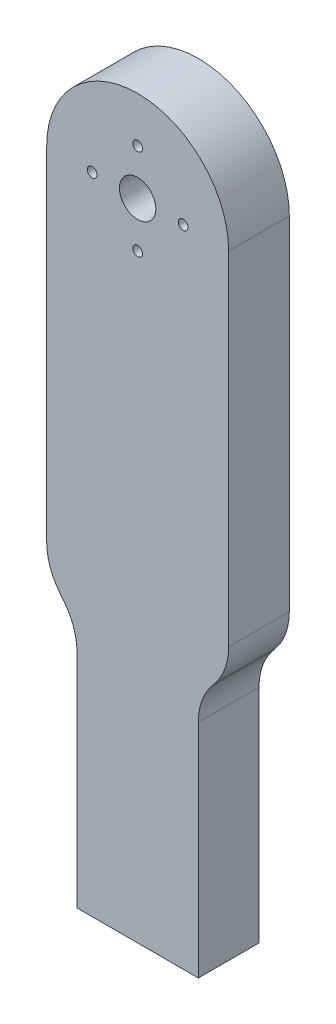
from build123d import *

# Parameters (mm, degrees)
ESQUISSE1_R        = 0.8
ESQUISSE1_R_2      = 3
BOSS_EXTRU_1_DEPTH = 5


with BuildPart() as part:
    # Esquisse1 → Boss.-Extru.1 (new, symmetric)
    with BuildSketch(Plane.XY):
        with BuildLine():
            ThreePointArc((15, 13.5), (10.606601718, 24.106601718), (0, 28.5))
            ThreePointArc((0, 28.5), (-10.606601718, 24.106601718), (-15, 13.5))
            Line((-15, 13.5), (-15, -43.010256567))
            ThreePointArc((-15, -43.010256567), (-14.441599081, -46.305132406), (-12.828758641, -49.232035906))
            Line((-12.828758641, -49.232035906), (-12.171241359, -50.059378669))
            ThreePointArc((-12.171241359, -50.059378669), (-10.558400919, -52.986282168), (-10, -56.281158007))
            Line((-10, -56.281158007), (-10, -92.791414574))
            Line((-10, -92.791414574), (10, -92.791414574))
            Line((10, -92.791414574), (10, -56.281158007))
            ThreePointArc((10, -56.281158007), (10.558400919, -52.986282168), (12.171241359, -50.059378669))
            Line((12.171241359, -50.059378669), (12.828758641, -49.232035906))
            ThreePointArc((12.828758641, -49.232035906), (14.441599081, -46.305132406), (15, -43.010256567))
            Line((15, -43.010256567), (15, 13.5))
        make_face()
        with Locations((-0.005270268, 5.998754805)):
            Circle(ESQUISSE1_R, mode=Mode.SUBTRACT)
        with Locations((7.494729732, 13.498754805)):
            Circle(ESQUISSE1_R, mode=Mode.SUBTRACT)
        with Locations((-0.005270268, 20.998754805)):
            Circle(ESQUISSE1_R, mode=Mode.SUBTRACT)
        with Locations((-7.505270268, 13.498754805)):
            Circle(ESQUISSE1_R, mode=Mode.SUBTRACT)
        with Locations((-0.005270268, 13.498754805)):
            Circle(ESQUISSE1_R_2, mode=Mode.SUBTRACT)
    extrude(amount=BOSS_EXTRU_1_DEPTH, both=True)


solid = part.part
